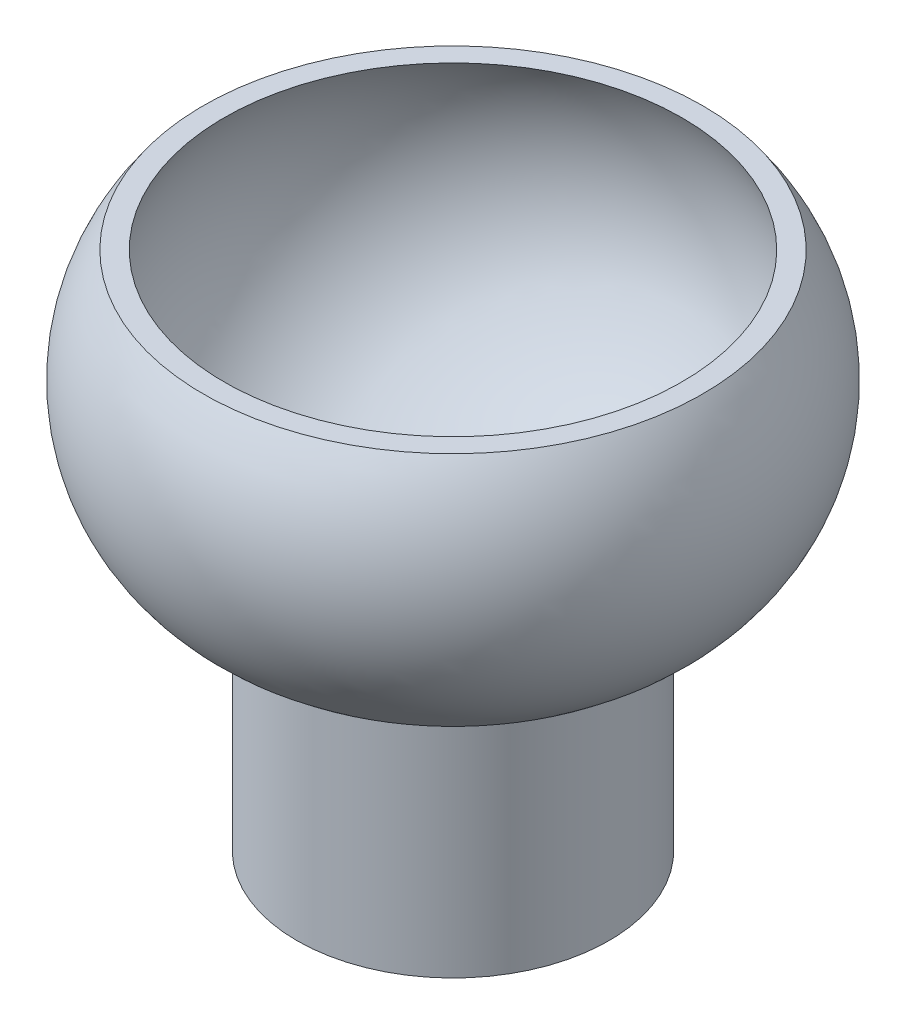
from build123d import *


with BuildPart() as part:
    # Sketch2 → Revolve2 (revolve)
    with BuildSketch(Plane.XY):
        with BuildLine():
            Line((0, 6.35), (0, 0))
            Line((0, 0), (3.81, 0))
            Line((3.81, 0), (3.81, 5.588))
            ThreePointArc((3.81, 5.588), (6.795567011, 8.551746318), (6.096, 12.7))
            Line((6.096, 12.7), (5.588, 12.7))
            ThreePointArc((5.588, 12.7), (5.094798551, 7.500297275), (0, 6.35))
        make_face()
    revolve(axis=Axis((0, 0, 0), (0, 1, 0)))


solid = part.part
